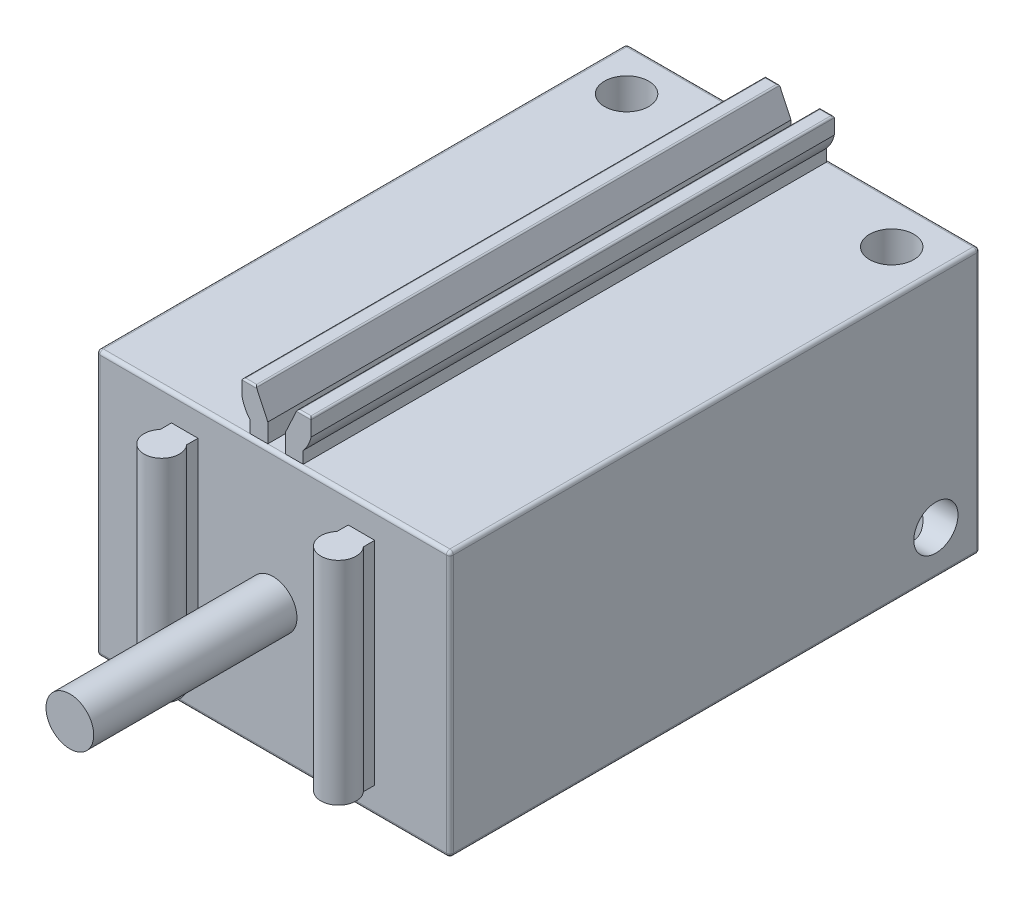
from build123d import *

# Parameters (mm, degrees)
SKETCH_1_W               = 20
SKETCH_1_H               = 15
EXTRUDE_1_DEPTH          = 30
EXTRUDE_2_DEPTH          = 6
EXTRUDE_2_DEPTH_BACK     = 6
SKETCH_3_R               = 1.35
EXTRUDE_3_DEPTH          = 11.5
EXTRUDE_START            = -0.2
EXTRUDE_4_DEPTH          = 29.6
EXTRUDE_5_DEPTH          = 14.6
FILLET_1_R               = 0.1
FILLET_2_R               = 0.2
SKETCH_6_R               = 1.25
CUT_EXTRUDE_1_DEPTH      = 38.165171868
SKETCH_7_R               = 1.25
CUT_EXTRUDE_2_DEPTH      = 40.449334595
SKETCH_8_R               = 1.25
CUT_EXTRUDE_3_DEPTH      = 5
CUT_EXTRUDE_4_DEPTH      = 5
CUT_EXTRUDE_4_DEPTH_BACK = 5
FILLET_3_R               = 0.1


with BuildPart() as part:
    # 草图1 → 凸台-拉伸1 (new body)
    with BuildSketch(Plane.XY):
        Rectangle(SKETCH_1_W, SKETCH_1_H)
    extrude(amount=-EXTRUDE_1_DEPTH)

    # 草图2 → 凸台-拉伸2 (add, two sides: drawn at the far end of the back side and taken through both)
    with BuildSketch(Plane(origin=(0, 0, 0), x_dir=(1, 0, 0), z_dir=(0, 1, 0)).offset(-EXTRUDE_2_DEPTH_BACK)):
        with BuildLine():
            Line((-4.25, 0), (-5.75, 0))
            Line((-5.75, 0), (-5.75, -0.638562172))
            ThreePointArc((-5.75, -0.638562172), (-5, -2.3), (-4.25, -0.638562172))
            Line((-4.25, -0.638562172), (-4.25, 0))
        make_face()
        with BuildLine():
            Line((4.25, 0), (4.25, -0.638562172))
            ThreePointArc((4.25, -0.638562172), (5, -2.3), (5.75, -0.638562172))
            Line((5.75, -0.638562172), (5.75, 0))
            Line((5.75, 0), (4.25, 0))
        make_face()
    extrude(amount=EXTRUDE_2_DEPTH + EXTRUDE_2_DEPTH_BACK)

    # 草图3 → 凸台-拉伸3 (add)
    with BuildSketch(Plane.XY):
        with Locations(Location((0, 0, 0), (0, 0, 180))):
            Circle(SKETCH_3_R)
    extrude(amount=EXTRUDE_3_DEPTH)

    # 草图4 → 凸台-拉伸4 (add)
    with BuildSketch(Plane.XY.offset(EXTRUDE_START)):
        with BuildLine():
            Line((-1.5, 7.5), (-1.5, 8.177124344))
            ThreePointArc((-1.5, 8.177124344), (-1.780042303, 8.588161527), (-1.95, 9.055590279))
            Line((-1.95, 9.055590279), (-1.95, 10))
            Line((-1.95, 10), (-1.165769145, 10))
            Line((-1.165769145, 10), (-0.5, 8.57225346))
            Line((-0.5, 8.57225346), (-0.5, 7.5))
            Line((-0.5, 7.5), (-1.5, 7.5))
        make_face()
        with BuildLine():
            Line((1.5, 7.5), (1.5, 8.177124344))
            ThreePointArc((1.5, 8.177124344), (1.780042303, 8.588161527), (1.95, 9.055590279))
            Line((1.95, 9.055590279), (1.95, 10))
            Line((1.95, 10), (1.165769145, 10))
            Line((1.165769145, 10), (0.5, 8.57225346))
            Line((0.5, 8.57225346), (0.5, 7.5))
            Line((0.5, 7.5), (1.5, 7.5))
        make_face()
    extrude(amount=-EXTRUDE_4_DEPTH)

    # 草图5 → 凸台-拉伸5 (add)
    with BuildSketch(Plane(origin=(0, 7.5, 0), x_dir=(-1, 0, 0), z_dir=(0, 1, 0)).offset(EXTRUDE_START)):
        with BuildLine():
            Line((1.5, -30), (1.5, -30.677124344))
            ThreePointArc((1.5, -30.677124344), (1.780042303, -31.088161527), (1.95, -31.555590279))
            Line((1.95, -31.555590279), (1.95, -32.5))
            Line((1.95, -32.5), (1.165769145, -32.5))
            Line((1.165769145, -32.5), (-1.165769145, -32.5))
            Line((-1.165769145, -32.5), (-1.95, -32.5))
            Line((-1.95, -32.5), (-1.95, -31.555590279))
            ThreePointArc((-1.95, -31.555590279), (-1.780042303, -31.088161527), (-1.5, -30.677124344))
            Line((-1.5, -30.677124344), (-1.5, -30))
            Line((-1.5, -30), (-0.5, -30))
            Line((-0.5, -30), (0.5, -30))
            Line((0.5, -30), (1.5, -30))
        make_face()
    extrude(amount=-EXTRUDE_5_DEPTH)

    # 圆角1
    fillet_1_edges = [part.edges().sort_by_distance(p)[0] for p in [
        (-1.557884573, 10, -29.8),
        (-1.95, 10, -15),
        (-1.165769145, 10, -15),
        (-1.557884573, 10, -0.2),
        (1.557884573, 10, -29.8),
        (1.165769145, 10, -15),
        (1.95, 10, -15),
        (1.557884573, 10, -0.2),
        (1.95, 0, -32.5),
        (0, -7.3, -32.5),
        (-1.95, 0, -32.5),
        (0, 7.3, -32.5),
    ]]
    fillet(fillet_1_edges, radius=FILLET_1_R)

    # 圆角2
    fillet_2_edges = [part.edges().sort_by_distance(p)[0] for p in [
        (10, 0, -30),
        (0, 7.5, -30),
        (-10, 0, -30),
        (0, 7.5, 0),
        (10, 0, 0),
        (0, -7.5, 0),
        (-10, 0, 0),
        (0, -7.5, -30),
        (-10, 7.5, -15),
        (10, 7.5, -15),
        (10, -7.5, -15),
        (-10, -7.5, -15),
    ]]
    fillet(fillet_2_edges, radius=FILLET_2_R - 0.0001)  # a hair under: the kernel refuses the full size

    # 草图6 → 切除-拉伸1 (cut, through all)
    with BuildSketch(Plane(origin=(0, 7.5, 0), x_dir=(-1, 0, 0), z_dir=(0, 1, 0))):
        with Locations(Location((7.5, -27.5, 0), (0, 0, 90))):
            Circle(SKETCH_6_R)
        with Locations(Location((-7.5, -27.5, 0), (0, 0, 90))):
            Circle(SKETCH_6_R)
    extrude(amount=-CUT_EXTRUDE_1_DEPTH, mode=Mode.SUBTRACT)

    # 草图7 → 切除-拉伸2 (cut, through all)
    with BuildSketch(Plane.ZY.offset(10)):
        with Locations((-27.5, -5)):
            Circle(SKETCH_7_R)
    extrude(amount=-CUT_EXTRUDE_2_DEPTH, mode=Mode.SUBTRACT)

    # 草图8 → 切除-拉伸3 (cut)
    with BuildSketch(Plane(origin=(0, 0, -30), x_dir=(-1, 0, 0), z_dir=(0, 0, -1))):
        with Locations((-7.5, 0)):
            Circle(SKETCH_8_R)
        with Locations((7.5, 0)):
            Circle(SKETCH_8_R)
    extrude(amount=-CUT_EXTRUDE_3_DEPTH, mode=Mode.SUBTRACT)

    # 草图9 → 切除-拉伸4 (cut, two sides: drawn at the far end of the back side and taken through both)
    with BuildSketch(Plane(origin=(0, 0, 0), x_dir=(0, 0, -1), z_dir=(1, 0, 0)).offset(-CUT_EXTRUDE_4_DEPTH_BACK)):
        with BuildLine():
            Line((32.5, 1.95), (31.555590279, 1.95))
            ThreePointArc((31.555590279, 1.95), (31.088161527, 1.780042303), (30.677124344, 1.5))
            Line((30.677124344, 1.5), (30, 1.5))
            Line((30, 1.5), (30, 7.95))
            Line((30, 7.95), (32.5, 7.95))
            Line((32.5, 7.95), (32.5, 1.95))
        make_face()
        with BuildLine():
            Line((30, -1.5), (30.677124344, -1.5))
            ThreePointArc((30.677124344, -1.5), (31.088161527, -1.780042303), (31.555590279, -1.95))
            Line((31.555590279, -1.95), (32.5, -1.95))
            Line((32.5, -1.95), (32.5, -7.95))
            Line((32.5, -7.95), (30, -7.95))
            Line((30, -7.95), (30, -1.5))
        make_face()
    extrude(amount=CUT_EXTRUDE_4_DEPTH + CUT_EXTRUDE_4_DEPTH_BACK, mode=Mode.SUBTRACT)

    # 圆角3
    fillet_3_edges = [part.edges().sort_by_distance(p)[0] for p in [
        (1.95, 1.95, -31.97779514),
        (1.920710678, 1.95, -32.470710678),
        (-1.95, 1.95, -31.97779514),
        (-1.920710678, 1.95, -32.470710678),
        (1.95, -1.95, -31.97779514),
        (1.920710678, -1.95, -32.470710678),
        (-1.95, -1.95, -31.97779514),
        (-1.920710678, -1.95, -32.470710678),
        (0, 1.95, -32.5),
        (0, -1.95, -32.5),
    ]]
    fillet(fillet_3_edges, radius=FILLET_3_R)


solid = part.part
